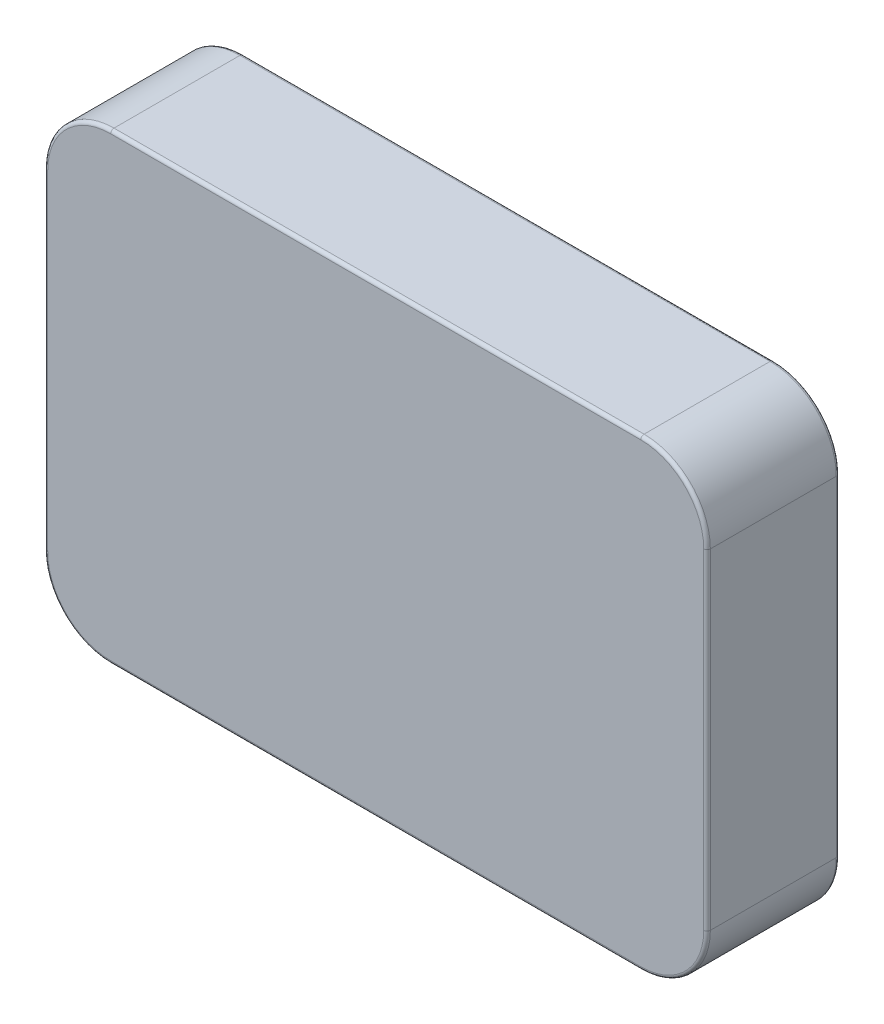
from build123d import *

# Parameters (mm, degrees)
SKETCH1_W           = 100
SKETCH1_H           = 69.85
BOSS_EXTRUDE1_DEPTH = 20
FILLET1_R           = 10
FILLET2_R           = 0.5


with BuildPart() as part:
    # Sketch1 → Boss-Extrude1 (new body)
    with BuildSketch(Plane.XY):
        Rectangle(SKETCH1_W, SKETCH1_H)
    extrude(amount=BOSS_EXTRUDE1_DEPTH)

    # Fillet1
    fillet1_edges = [part.edges().sort_by_distance(p)[0] for p in [
        (-50, -34.925, 10),
        (50, -34.925, 10),
        (50, 34.925, 10),
        (-50, 34.925, 10),
    ]]
    fillet(fillet1_edges, radius=FILLET1_R)

    # Fillet2
    fillet2_edges = [part.edges().sort_by_distance(p)[0] for p in [
        (47.071067812, 31.996067812, 0),
        (50, 0, 0),
        (47.071067812, -31.996067812, 0),
        (0, -34.925, 0),
        (-47.071067812, -31.996067812, 0),
        (-50, 0, 0),
        (-47.071067812, 31.996067812, 0),
        (47.071067812, 31.996067812, 20),
        (50, 0, 20),
        (47.071067812, -31.996067812, 20),
        (0, -34.925, 20),
        (-47.071067812, -31.996067812, 20),
        (-50, 0, 20),
        (-47.071067812, 31.996067812, 20),
        (0, 34.925, 0),
        (0, 34.925, 20),
    ]]
    fillet(fillet2_edges, radius=FILLET2_R)


solid = part.part
